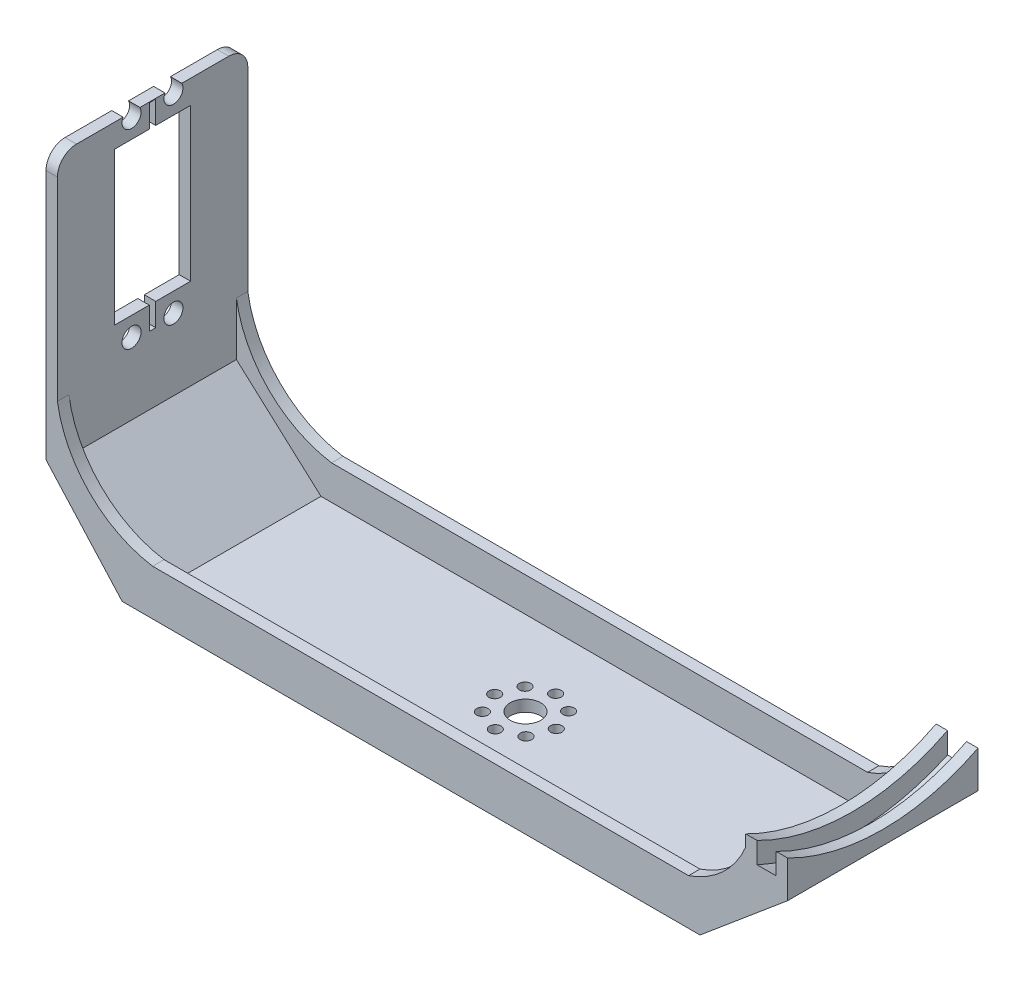
from build123d import *
from OCP.BRepFilletAPI import BRepFilletAPI_MakeChamfer

# Parameters (mm, degrees)
SKETCH1_W           = 194.75
SKETCH1_H           = 50
BOSS_EXTRUDE1_DEPTH = 3
BOSS_EXTRUDE2_START = -3
BOSS_EXTRUDE2_DEPTH = 5
BOSS_EXTRUDE3_DEPTH = 3
BOSS_EXTRUDE4_START = -3
BOSS_EXTRUDE4_DEPTH = 3
SKETCH6_W           = 50
SKETCH6_H           = 90
BOSS_EXTRUDE5_DEPTH = 3
BOSS_EXTRUDE6_REACH = 216.574
SKETCH7_W           = 3
SKETCH7_H           = 9
RIB1_START          = -3
RIB1_DEPTH          = 3
LPATTERN1_COUNT     = 2
LPATTERN1_PITCH     = 47
RIB2_START          = -3
RIB2_DEPTH          = 3
LPATTERN2_COUNT     = 2
LPATTERN2_PITCH     = 47
CUT_EXTRUDE1_REACH  = 175.963
SKETCH10_R          = 4
SKETCH10_R_2        = 1.5
FILLET1_R           = 5
CHAMFER1_SIZE       = 20
CHAMFER1_SIZE2      = 22.212250297
CHAMFER2_SIZE       = 20
CHAMFER2_SIZE2      = 14.004150764
CHAMFER3_SIZE       = 23
CHAMFER3_SIZE2      = 19.299291517
CUT_EXTRUDE2_REACH  = 219.259
SKETCH11_W          = 1.7
SKETCH11_H          = 6
SKETCH11_R          = 2.5


# Read off the part's stored shape, not the designer's step: Rib1, Rib2
with BuildPart() as part:
    # Sketch1 → Boss-Extrude1 (new body)
    with BuildSketch(Plane(origin=(0, 0, 0), x_dir=(1, 0, 0), z_dir=(0, 1, 0))):
        with Locations((49.3836315, 0)):
            Rectangle(SKETCH1_W, SKETCH1_H)
    extrude(amount=BOSS_EXTRUDE1_DEPTH)

    # Sketch2 → Boss-Extrude2 (add)
    with BuildSketch(Plane(origin=(146.7586315, 0, 0), x_dir=(0, 0, -1), z_dir=(1, 0, 0)).offset(BOSS_EXTRUDE2_START)):
        with BuildLine():
            Line((25, 3), (25, 23.456439427))
            ThreePointArc((25, 23.456439427), (0, 18), (-25, 23.456439427))
            Line((-25, 23.456439427), (-25, 3))
            Line((-25, 3), (25, 3))
        make_face()
    extrude(amount=-BOSS_EXTRUDE2_DEPTH)

    # Sketch3 → Boss-Extrude3 (add)
    with BuildSketch(Plane(origin=(143.7586315, 0, 0), x_dir=(0, 0, -1), z_dir=(1, 0, 0))):
        with BuildLine():
            Line((-25, 3), (25, 3))
            Line((25, 3), (25, 29.010205144))
            ThreePointArc((25, 29.010205144), (0, 23), (-25, 29.010205144))
            Line((-25, 29.010205144), (-25, 3))
        make_face()
    extrude(amount=BOSS_EXTRUDE3_DEPTH)

    # Sketch4 → Boss-Extrude4 (add)
    with BuildSketch(Plane(origin=(138.7586315, 0, 0), x_dir=(0, 0, -1), z_dir=(1, 0, 0)).offset(BOSS_EXTRUDE4_START)):
        with BuildLine():
            Line((-25, 0), (-25, 29.010205144))
            ThreePointArc((-25, 29.010205144), (0, 23), (25, 29.010205144))
            Line((25, 29.010205144), (25, 0))
            Line((25, 0), (-25, 0))
        make_face()
    extrude(amount=BOSS_EXTRUDE4_DEPTH)

    # Sketch6 → Boss-Extrude5 (add)
    with BuildSketch(Plane.ZY.offset(47.9913685)):
        with Locations((0, 48)):
            Rectangle(SKETCH6_W, SKETCH6_H)
    extrude(amount=-BOSS_EXTRUDE5_DEPTH)

    # Sketch7 → Boss-Extrude6 (add, up to next)
    with BuildSketch(Plane(origin=(-44.9913685, 0, 0), x_dir=(0, 0, -1), z_dir=(1, 0, 0)), mode=Mode.PRIVATE) as boss_extrude6_sk1:
        with Locations((-23.5, 7.5)):
            Rectangle(SKETCH7_W, SKETCH7_H)
    boss_extrude6_tool1 = extrude(boss_extrude6_sk1.sketch, amount=BOSS_EXTRUDE6_REACH, mode=Mode.PRIVATE) - part.part
    # Sketch7 → Boss-Extrude6 (add, up to next)
    with BuildSketch(Plane(origin=(-44.9913685, 0, 0), x_dir=(0, 0, -1), z_dir=(1, 0, 0)), mode=Mode.PRIVATE) as boss_extrude6_sk2:
        with Locations((23.5, 7.5)):
            Rectangle(SKETCH7_W, SKETCH7_H)
    boss_extrude6_tool2 = extrude(boss_extrude6_sk2.sketch, amount=BOSS_EXTRUDE6_REACH, mode=Mode.PRIVATE) - part.part
    add(boss_extrude6_tool1.solids().sort_by_distance((-44.991369, 7.5, 23.5))[0])
    add(boss_extrude6_tool2.solids().sort_by_distance((-44.991369, 7.5, -23.5))[0])

    # Rib1 outline → Rib1 (add)
    with BuildSketch(Plane.XY.offset(25).offset(RIB1_START)):
        with BuildLine():
            ThreePointArc((-19.991368497, 11.999999999), (-36.565435434, 20.425933064), (-44.9913685, 37))
            Line((-44.9913685, 37), (-44.9913685, 12))
            Line((-44.9913685, 12), (-19.991368497, 11.999999999))
        make_face()
    rib1 = extrude(amount=RIB1_DEPTH)

    # LPattern1: Rib1 ×2
    with Locations(*[(0, 0, -i * LPATTERN1_PITCH) for i in range(1, LPATTERN1_COUNT)]):
        add(rib1)

    # Rib2 outline → Rib2 (add)
    with BuildSketch(Plane.XY.offset(25).offset(RIB2_START)):
        with BuildLine():
            ThreePointArc((135.7586315, 26.007069295), (129.762224626, 17.393355072), (120.7586315, 12))
            Line((120.7586315, 12), (135.7586315, 12))
            Line((135.7586315, 12), (135.7586315, 26.007069295))
        make_face()
    rib2 = extrude(amount=RIB2_DEPTH)

    # LPattern2: Rib2 ×2
    with Locations(*[(0, 0, -i * LPATTERN2_PITCH) for i in range(1, LPATTERN2_COUNT)]):
        add(rib2)

    # Sketch10 → Cut-Extrude1 (cut, up to next)
    with BuildSketch(Plane(origin=(0, 3, 0), x_dir=(1, 0, 0), z_dir=(0, 1, 0)), mode=Mode.PRIVATE) as cut_extrude1_sk1:
        with Locations(Location((53.0086315, -0.085435095, 0), (0, 0, 270))):
            Circle(SKETCH10_R)
    cut_extrude1_tool1 = extrude(cut_extrude1_sk1.sketch, amount=-CUT_EXTRUDE1_REACH, mode=Mode.PRIVATE) & part.part
    # Sketch10 → Cut-Extrude1 (cut, up to next)
    with BuildSketch(Plane(origin=(0, 3, 0), x_dir=(1, 0, 0), z_dir=(0, 1, 0)), mode=Mode.PRIVATE) as cut_extrude1_sk2:
        with Locations(Location((61.0086315, -2.1452e-05, 0), (0, 0, 270))):
            Circle(SKETCH10_R_2)
    cut_extrude1_tool2 = extrude(cut_extrude1_sk2.sketch, amount=-CUT_EXTRUDE1_REACH, mode=Mode.PRIVATE) & part.part
    # Sketch10 → Cut-Extrude1 (cut, up to next)
    with BuildSketch(Plane(origin=(0, 3, 0), x_dir=(1, 0, 0), z_dir=(0, 1, 0)), mode=Mode.PRIVATE) as cut_extrude1_sk3:
        with Locations(Location((58.725882315, -5.681892778, 0), (0, 0, 270))):
            Circle(SKETCH10_R_2)
    cut_extrude1_tool3 = extrude(cut_extrude1_sk3.sketch, amount=-CUT_EXTRUDE1_REACH, mode=Mode.PRIVATE) & part.part
    # Sketch10 → Cut-Extrude1 (cut, up to next)
    with BuildSketch(Plane(origin=(0, 3, 0), x_dir=(1, 0, 0), z_dir=(0, 1, 0)), mode=Mode.PRIVATE) as cut_extrude1_sk4:
        with Locations(Location((53.094045142, -8.085435095, 0), (0, 0, 270))):
            Circle(SKETCH10_R_2)
    cut_extrude1_tool4 = extrude(cut_extrude1_sk4.sketch, amount=-CUT_EXTRUDE1_REACH, mode=Mode.PRIVATE) & part.part
    # Sketch10 → Cut-Extrude1 (cut, up to next)
    with BuildSketch(Plane(origin=(0, 3, 0), x_dir=(1, 0, 0), z_dir=(0, 1, 0)), mode=Mode.PRIVATE) as cut_extrude1_sk5:
        with Locations(Location((47.412173816, -5.80268591, 0), (0, 0, 270))):
            Circle(SKETCH10_R_2)
    cut_extrude1_tool5 = extrude(cut_extrude1_sk5.sketch, amount=-CUT_EXTRUDE1_REACH, mode=Mode.PRIVATE) & part.part
    # Sketch10 → Cut-Extrude1 (cut, up to next)
    with BuildSketch(Plane(origin=(0, 3, 0), x_dir=(1, 0, 0), z_dir=(0, 1, 0)), mode=Mode.PRIVATE) as cut_extrude1_sk6:
        with Locations(Location((45.0086315, -0.170848737, 0), (0, 0, 270))):
            Circle(SKETCH10_R_2)
    cut_extrude1_tool6 = extrude(cut_extrude1_sk6.sketch, amount=-CUT_EXTRUDE1_REACH, mode=Mode.PRIVATE) & part.part
    # Sketch10 → Cut-Extrude1 (cut, up to next)
    with BuildSketch(Plane(origin=(0, 3, 0), x_dir=(1, 0, 0), z_dir=(0, 1, 0)), mode=Mode.PRIVATE) as cut_extrude1_sk7:
        with Locations(Location((47.291380684, 5.511022589, 0), (0, 0, 270))):
            Circle(SKETCH10_R_2)
    cut_extrude1_tool7 = extrude(cut_extrude1_sk7.sketch, amount=-CUT_EXTRUDE1_REACH, mode=Mode.PRIVATE) & part.part
    # Sketch10 → Cut-Extrude1 (cut, up to next)
    with BuildSketch(Plane(origin=(0, 3, 0), x_dir=(1, 0, 0), z_dir=(0, 1, 0)), mode=Mode.PRIVATE) as cut_extrude1_sk8:
        with Locations(Location((52.923217857, 7.914564905, 0), (0, 0, 270))):
            Circle(SKETCH10_R_2)
    cut_extrude1_tool8 = extrude(cut_extrude1_sk8.sketch, amount=-CUT_EXTRUDE1_REACH, mode=Mode.PRIVATE) & part.part
    # Sketch10 → Cut-Extrude1 (cut, up to next)
    with BuildSketch(Plane(origin=(0, 3, 0), x_dir=(1, 0, 0), z_dir=(0, 1, 0)), mode=Mode.PRIVATE) as cut_extrude1_sk9:
        with Locations(Location((58.605089183, 5.631815721, 0), (0, 0, 270))):
            Circle(SKETCH10_R_2)
    cut_extrude1_tool9 = extrude(cut_extrude1_sk9.sketch, amount=-CUT_EXTRUDE1_REACH, mode=Mode.PRIVATE) & part.part
    add(cut_extrude1_tool1.solids().sort_by_distance((53.008631, 3, 0.085435))[0], mode=Mode.SUBTRACT)
    add(cut_extrude1_tool2.solids().sort_by_distance((61.008631, 3, 2.1e-05))[0], mode=Mode.SUBTRACT)
    add(cut_extrude1_tool3.solids().sort_by_distance((58.725882, 3, 5.681893))[0], mode=Mode.SUBTRACT)
    add(cut_extrude1_tool4.solids().sort_by_distance((53.094045, 3, 8.085435))[0], mode=Mode.SUBTRACT)
    add(cut_extrude1_tool5.solids().sort_by_distance((47.412174, 3, 5.802686))[0], mode=Mode.SUBTRACT)
    add(cut_extrude1_tool6.solids().sort_by_distance((45.008631, 3, 0.170849))[0], mode=Mode.SUBTRACT)
    add(cut_extrude1_tool7.solids().sort_by_distance((47.291381, 3, -5.511023))[0], mode=Mode.SUBTRACT)
    add(cut_extrude1_tool8.solids().sort_by_distance((52.923218, 3, -7.914565))[0], mode=Mode.SUBTRACT)
    add(cut_extrude1_tool9.solids().sort_by_distance((58.605089, 3, -5.631816))[0], mode=Mode.SUBTRACT)

    # Fillet1
    fillet1_edges = [part.edges().sort_by_distance(p)[0] for p in [
        (-46.4913685, 93, 25),
        (-46.4913685, 93, -25),
    ]]
    fillet(fillet1_edges, radius=FILLET1_R)

    # Chamfer1: one chamfer whose edges measure the first distance from different faces: ONE call of the kernel's chamfer builder (chamfer() names one face for all edges)
    chamfer1_edges_1 = [part.edges().sort_by_distance(p)[0] for p in [
        (-47.9913685, 0, 0),
    ]]
    chamfer1_side_1 = [part.faces().sort_by_distance(p)[0] for p in [
        (-45.98070785, 0, 0),
    ]]
    chamfer1_edges_2 = [part.edges().sort_by_distance(p)[0] for p in [
        (-44.9913685, 3, 0),
    ]]
    chamfer1_side_2 = [part.faces().sort_by_distance(p)[0] for p in [
        (-44.9913685, 49.22305707, 0),
    ]]
    chamfer1 = BRepFilletAPI_MakeChamfer(part.part.solid().wrapped)
    for e in chamfer1_edges_1:
        chamfer1.Add(CHAMFER1_SIZE, CHAMFER1_SIZE2, e.wrapped, chamfer1_side_1[0].wrapped)  # the first distance lies on this face
    for e in chamfer1_edges_2:
        chamfer1.Add(CHAMFER1_SIZE, CHAMFER1_SIZE2, e.wrapped, chamfer1_side_2[0].wrapped)  # the first distance lies on this face
    add(Compound.cast(chamfer1.Shape()), mode=Mode.REPLACE)

    # Chamfer2
    chamfer2_edges = [part.edges().sort_by_distance(p)[0] for p in [
        (135.7586315, 3, 0),
    ]]
    chamfer2_side = [part.faces().sort_by_distance(p)[0] for p in [
        (56.489756648, 3, -20.354697047),
    ]]
    chamfer(chamfer2_edges, length=CHAMFER2_SIZE, length2=CHAMFER2_SIZE2, reference=chamfer2_side[0])

    # Chamfer3
    chamfer3_edges = [part.edges().sort_by_distance(p)[0] for p in [
        (146.7586315, 0, 0),
    ]]
    chamfer3_side = [part.faces().sort_by_distance(p)[0] for p in [
        (59.462529077, 0, -0.001057352),
    ]]
    chamfer(chamfer3_edges, length=CHAMFER3_SIZE, length2=CHAMFER3_SIZE2, reference=chamfer3_side[0])

    # Sketch11 → Cut-Extrude2 (cut, up to next)
    with BuildSketch(Plane.ZY.offset(47.9913685), mode=Mode.PRIVATE) as cut_extrude2_sk1:
        with Locations((0.032606221, 89.827764741)):
            Rectangle(SKETCH11_W, SKETCH11_H)
    cut_extrude2_tool1 = extrude(cut_extrude2_sk1.sketch, amount=-CUT_EXTRUDE2_REACH, mode=Mode.PRIVATE) & part.part
    # Sketch11 → Cut-Extrude2 (cut, up to next)
    with BuildSketch(Plane.ZY.offset(47.9913685), mode=Mode.PRIVATE) as cut_extrude2_sk2:
        Polygon((0.882606221, 86.827764741), (-0.817393779, 86.827764741), (-9.967393779, 86.827764741), (-9.967393779, 46.827764741), (-0.817393779, 46.827764741), (0.882606221, 46.827764741), (10.032606221, 46.827764741), (10.032606221, 86.827764741), align=None)
    cut_extrude2_tool2 = extrude(cut_extrude2_sk2.sketch, amount=-CUT_EXTRUDE2_REACH, mode=Mode.PRIVATE) & part.part
    # Sketch11 → Cut-Extrude2 (cut, up to next)
    with BuildSketch(Plane.ZY.offset(47.9913685), mode=Mode.PRIVATE) as cut_extrude2_sk3:
        with Locations((-5.467393779, 91.827764741)):
            Circle(SKETCH11_R)
    cut_extrude2_tool3 = extrude(cut_extrude2_sk3.sketch, amount=-CUT_EXTRUDE2_REACH, mode=Mode.PRIVATE) & part.part
    # Sketch11 → Cut-Extrude2 (cut, up to next)
    with BuildSketch(Plane.ZY.offset(47.9913685), mode=Mode.PRIVATE) as cut_extrude2_sk4:
        with Locations((5.532606221, 91.827764741)):
            Circle(SKETCH11_R)
    cut_extrude2_tool4 = extrude(cut_extrude2_sk4.sketch, amount=-CUT_EXTRUDE2_REACH, mode=Mode.PRIVATE) & part.part
    # Sketch11 → Cut-Extrude2 (cut, up to next)
    with BuildSketch(Plane.ZY.offset(47.9913685), mode=Mode.PRIVATE) as cut_extrude2_sk5:
        with Locations((0.032606221, 43.827764741)):
            Rectangle(SKETCH11_W, SKETCH11_H)
    cut_extrude2_tool5 = extrude(cut_extrude2_sk5.sketch, amount=-CUT_EXTRUDE2_REACH, mode=Mode.PRIVATE) & part.part
    # Sketch11 → Cut-Extrude2 (cut, up to next)
    with BuildSketch(Plane.ZY.offset(47.9913685), mode=Mode.PRIVATE) as cut_extrude2_sk6:
        with Locations((-5.467393779, 41.827764741)):
            Circle(SKETCH11_R)
    cut_extrude2_tool6 = extrude(cut_extrude2_sk6.sketch, amount=-CUT_EXTRUDE2_REACH, mode=Mode.PRIVATE) & part.part
    # Sketch11 → Cut-Extrude2 (cut, up to next)
    with BuildSketch(Plane.ZY.offset(47.9913685), mode=Mode.PRIVATE) as cut_extrude2_sk7:
        with Locations((5.532606221, 41.827764741)):
            Circle(SKETCH11_R)
    cut_extrude2_tool7 = extrude(cut_extrude2_sk7.sketch, amount=-CUT_EXTRUDE2_REACH, mode=Mode.PRIVATE) & part.part
    add(cut_extrude2_tool1.solids().sort_by_distance((-47.991369, 89.827765, 0.032606))[0], mode=Mode.SUBTRACT)
    add(cut_extrude2_tool2.solids().sort_by_distance((-47.991369, 66.827765, 0.032606))[0], mode=Mode.SUBTRACT)
    add(cut_extrude2_tool3.solids().sort_by_distance((-47.991369, 91.827765, -5.467394))[0], mode=Mode.SUBTRACT)
    add(cut_extrude2_tool4.solids().sort_by_distance((-47.991369, 91.827765, 5.532606))[0], mode=Mode.SUBTRACT)
    add(cut_extrude2_tool5.solids().sort_by_distance((-47.991369, 43.827765, 0.032606))[0], mode=Mode.SUBTRACT)
    add(cut_extrude2_tool6.solids().sort_by_distance((-47.991369, 41.827765, -5.467394))[0], mode=Mode.SUBTRACT)
    add(cut_extrude2_tool7.solids().sort_by_distance((-47.991369, 41.827765, 5.532606))[0], mode=Mode.SUBTRACT)


solid = part.part
